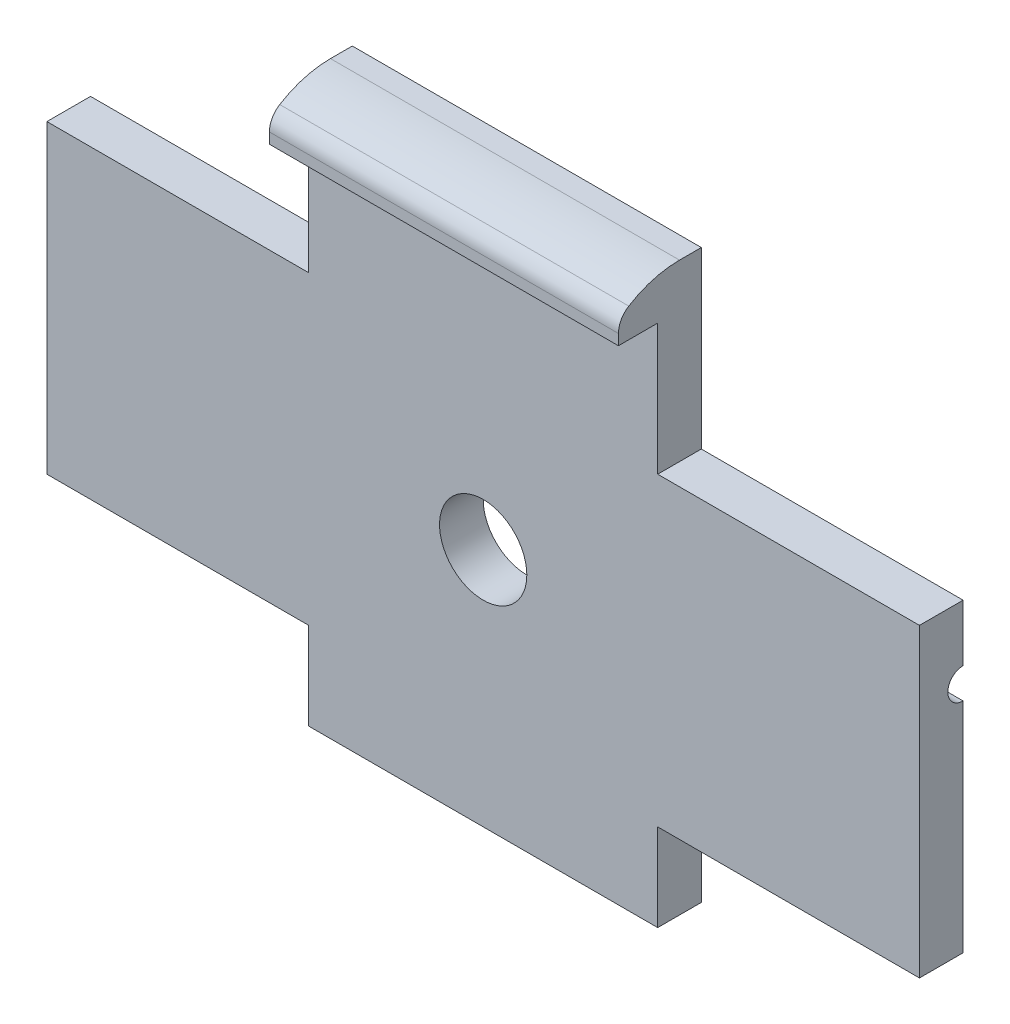
from build123d import *

# Parameters (mm, degrees)
SALIENTE_EXTRUIR1_DEPTH             = 0.5
CROQUIS2_R                          = 0.5
CORTAR_EXTRUIR1_DEPTH               = 0.5
SALIENTE_EXTRUIR2_REACH             = 7.984
SALIENTE_EXTRUIR2_DIRECTION_2_REACH = 7.984


# Read off the part's stored shape, not the designer's step: Diámetro de taladro Ø0.35 (0.35)1
with BuildPart() as part:
    # Croquis1 → Saliente-Extruir1 (new body)
    with BuildSketch(Plane.XY):
        Polygon((-5, 1.75), (-5, -1.75), (-2, -1.75), (-2, -2.75), (2, -2.75), (2, -1.75), (5, -1.75), (5, 1.75), (2, 1.75), (2, 3.25), (-2, 3.25), (-2, 1.75), align=None)
    extrude(amount=SALIENTE_EXTRUIR1_DEPTH)

    # Croquis2 → Cortar-Extruir1 (cut)
    with BuildSketch(Plane.XY.offset(0.5)):
        Circle(CROQUIS2_R)
    extrude(amount=-CORTAR_EXTRUIR1_DEPTH, mode=Mode.SUBTRACT)

    # Saliente-Extruir2: up to this face of the body (flat: up to its plane)
    saliente_extruir2_end = Plane(part.part.faces().sort_by_distance((2, 2.5, 0.25))[0])
    # Croquis3 → Saliente-Extruir2 (add, up to the picked face)
    with BuildSketch(Plane(origin=(0, 0, 0), x_dir=(0, 0, -1), z_dir=(1, 0, 0)), mode=Mode.PRIVATE) as saliente_extruir2_sk1:
        with BuildLine():
            Line((-0.95, 3.25), (-0.95, 3.371997249))
            ThreePointArc((-0.95, 3.371997249), (-0.918397272, 3.493663315), (-0.831578947, 3.584569544))
            ThreePointArc((-0.831578947, 3.584569544), (-0.55232487, 3.707838028), (-0.25, 3.75))
            Line((-0.25, 3.75), (0, 3.75))
            Line((0, 3.75), (0, 3.25))
            Line((0, 3.25), (-0.95, 3.25))
        make_face()
    saliente_extruir2_tool1 = split(extrude(saliente_extruir2_sk1.sketch, amount=SALIENTE_EXTRUIR2_REACH, mode=Mode.PRIVATE), bisect_by=saliente_extruir2_end, keep=Keep.BOTH, mode=Mode.PRIVATE)
    add(saliente_extruir2_tool1.solids().sort_by(Axis((0, 3.476563, 0.431746), (1, 0, 0)))[0])

    # Saliente-Extruir2 direction 2: up to this face of the body (flat: up to its plane)
    saliente_extruir2_direction_2_end = Plane(part.part.faces().sort_by_distance((-2, 2.5, 0.25))[0])
    # Croquis3 → Saliente-Extruir2 direction 2 (add, up to the picked face)
    with BuildSketch(Plane(origin=(0, 0, 0), x_dir=(0, 0, -1), z_dir=(1, 0, 0)), mode=Mode.PRIVATE) as saliente_extruir2_direction_2_sk1:
        with BuildLine():
            Line((-0.95, 3.25), (-0.95, 3.371997249))
            ThreePointArc((-0.95, 3.371997249), (-0.918397272, 3.493663315), (-0.831578947, 3.584569544))
            ThreePointArc((-0.831578947, 3.584569544), (-0.55232487, 3.707838028), (-0.25, 3.75))
            Line((-0.25, 3.75), (0, 3.75))
            Line((0, 3.75), (0, 3.25))
            Line((0, 3.25), (-0.95, 3.25))
        make_face()
    saliente_extruir2_direction_2_tool1 = split(extrude(saliente_extruir2_direction_2_sk1.sketch, amount=-SALIENTE_EXTRUIR2_DIRECTION_2_REACH, mode=Mode.PRIVATE), bisect_by=saliente_extruir2_direction_2_end, keep=Keep.BOTH, mode=Mode.PRIVATE)
    add(saliente_extruir2_direction_2_tool1.solids().sort_by(Axis((0, 3.476563, 0.431746), (-1, 0, 0)))[0])

    # Diámetro de taladro Ø0.35 (0.35)1 outlin → Diámetro de taladro Ø0.35 (0.35)1 (revolve, cut)
    with BuildSketch(Plane(origin=(0, 0.925, 0), x_dir=(0, 1, 0), z_dir=(0, 0, -1))):
        Polygon((0.175, -5), (0.175, -2), (0, -1.894849392), (0, -5), align=None)
        Polygon((0, 5), (0, 1.894849392), (0.175, 2), (0.175, 5), align=None)
    revolve(axis=Axis((0, 0.925, 0), (1, 0, 0)), mode=Mode.SUBTRACT)


solid = part.part
